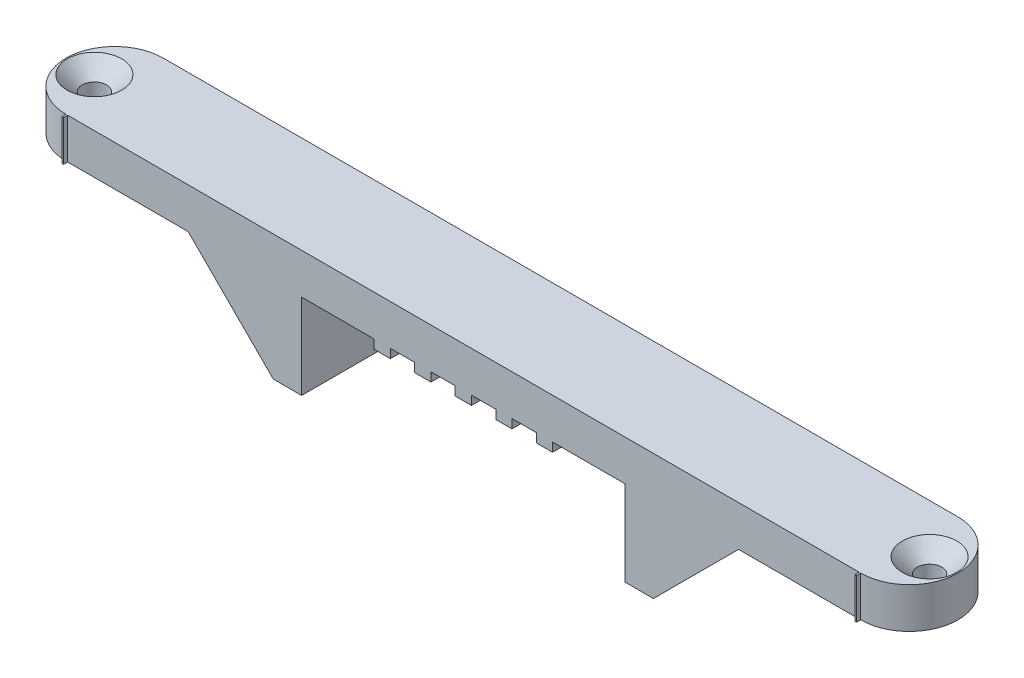
from build123d import *

# Parameters (mm, degrees)
SKETCH1_R                     = 1.5
BOSS_EXTRUDE1_DEPTH           = 3
SKETCH4_W                     = 3.5
SKETCH4_H                     = 12
BOSS_EXTRUDE3_DEPTH           = 10.5
SKETCH5_W                     = 2
SKETCH5_H                     = 12
BOSS_EXTRUDE4_DEPTH           = 1.1
SKETCH6_W                     = 0.2
SKETCH6_H                     = 3
BOSS_EXTRUDE5_DEPTH           = 0.5
CHAMFER1_SIZE                 = 10.5
F_3_0MM_DOWEL_HOLE1_D         = 3
F_3_0MM_DOWEL_HOLE1_DEPTH     = 13.5
SKETCH10_R                    = 1.5
BOSS_EXTRUDE6_DEPTH           = 2
CSK_FOR_M3_SFHCS1_D           = 3
CSK_FOR_M3_SFHCS1_DEPTH       = 31.098709071
CSK_FOR_M3_SFHCS1_CSINK_D     = 6.72
CSK_FOR_M3_SFHCS1_CSINK_ANGLE = 90
CSK_FOR_M3_SFHCS1_TIP         = 0.901290929


with BuildPart() as part:
    # Sketch1 → Boss-Extrude1 (new body)
    with BuildSketch(Plane(origin=(0, 0, 0), x_dir=(1, 0, 0), z_dir=(0, 1, 0))):
        with BuildLine():
            Line((-49, 6), (49, 6))
            ThreePointArc((49, 6), (55, 0), (49, -6))
            Line((49, -6), (-49, -6))
            ThreePointArc((-49, -6), (-55, 0), (-49, 6))
        make_face()
        with Locations(Location((-51.5, 0, 0), (0, 0, 270))):
            Circle(SKETCH1_R, mode=Mode.SUBTRACT)
        with Locations(Location((51.5, 0, 0), (0, 0, 270))):
            Circle(SKETCH1_R, mode=Mode.SUBTRACT)
    extrude(amount=BOSS_EXTRUDE1_DEPTH)

    # Sketch4 → Boss-Extrude3 (add)
    with BuildSketch(Plane.XZ):
        with Locations((-21.690023983, 0)):
            Rectangle(SKETCH4_W, SKETCH4_H)
        with Locations((21.690023983, 0)):
            Rectangle(SKETCH4_W, SKETCH4_H)
    extrude(amount=BOSS_EXTRUDE3_DEPTH)

    # Sketch5 → Boss-Extrude4 (add)
    with BuildSketch(Plane.XZ):
        with Locations((5, 0)):
            Rectangle(SKETCH5_W, SKETCH5_H)
        Rectangle(SKETCH5_W, SKETCH5_H)
        with Locations((10, 0)):
            Rectangle(SKETCH5_W, SKETCH5_H)
        with Locations((-5, 0)):
            Rectangle(SKETCH5_W, SKETCH5_H)
        with Locations((-10, 0)):
            Rectangle(SKETCH5_W, SKETCH5_H)
    extrude(amount=BOSS_EXTRUDE4_DEPTH)

    # Sketch6 → Boss-Extrude5 (add)
    with BuildSketch(Plane.XY.offset(6)):
        with Locations((48.9, 1.5)):
            Rectangle(SKETCH6_W, SKETCH6_H)
        with Locations((-48.9, 1.5)):
            Rectangle(SKETCH6_W, SKETCH6_H)
    extrude(amount=BOSS_EXTRUDE5_DEPTH)

    # Chamfer1
    chamfer1_edges = [part.edges().sort_by_distance(p)[0] for p in [
        (23.440023983, 0, 0),
        (-23.440023983, 0, 0),
    ]]
    chamfer(chamfer1_edges, length=CHAMFER1_SIZE - 0.0001)  # a hair under: the kernel refuses the full size

    # Ø3.0mm Dowel Hole1
    with Locations(Plane(origin=(0, 3, 0), x_dir=(1, 0, 0), z_dir=(0, 1, 0))):
        with Locations((-51.5, 0), (51.5, 0)):
            Hole(F_3_0MM_DOWEL_HOLE1_D / 2, depth=F_3_0MM_DOWEL_HOLE1_DEPTH)

    # Sketch10 → Boss-Extrude6 (add)
    with BuildSketch(Plane(origin=(0, 3, 0), x_dir=(1, 0, 0), z_dir=(0, 1, 0))):
        with BuildLine():
            Line((-49, -6), (-49, -6.5))
            Line((-49, -6.5), (-48.8, -6.5))
            Line((-48.8, -6.5), (-48.8, -6))
            Line((-48.8, -6), (48.8, -6))
            Line((48.8, -6), (48.8, -6.5))
            Line((48.8, -6.5), (49, -6.5))
            Line((49, -6.5), (49, -6))
            ThreePointArc((49, -6), (55, 0), (49, 6))
            Line((49, 6), (-49, 6))
            ThreePointArc((-49, 6), (-55, 0), (-49, -6))
        make_face()
        with Locations(Location((-51.5, 0, 0), (0, 0, 270))):
            Circle(SKETCH10_R, mode=Mode.SUBTRACT)
        with Locations(Location((51.5, 0, 0), (0, 0, 270))):
            Circle(SKETCH10_R, mode=Mode.SUBTRACT)
    extrude(amount=BOSS_EXTRUDE6_DEPTH)

    # CSK for M3 SFHCS1
    with Locations(Plane(origin=(0, 5, 0), x_dir=(1, 0, 0), z_dir=(0, 1, 0))):
        with Locations((51.5, 0), (-51.5, 0)):
            CounterSinkHole(CSK_FOR_M3_SFHCS1_D / 2, CSK_FOR_M3_SFHCS1_CSINK_D / 2, depth=CSK_FOR_M3_SFHCS1_DEPTH, counter_sink_angle=CSK_FOR_M3_SFHCS1_CSINK_ANGLE)
            with Locations((0, 0, -(CSK_FOR_M3_SFHCS1_DEPTH + CSK_FOR_M3_SFHCS1_TIP / 2))):  # 118° drill point
                Cone(0, CSK_FOR_M3_SFHCS1_D / 2, CSK_FOR_M3_SFHCS1_TIP, mode=Mode.SUBTRACT)


solid = part.part
